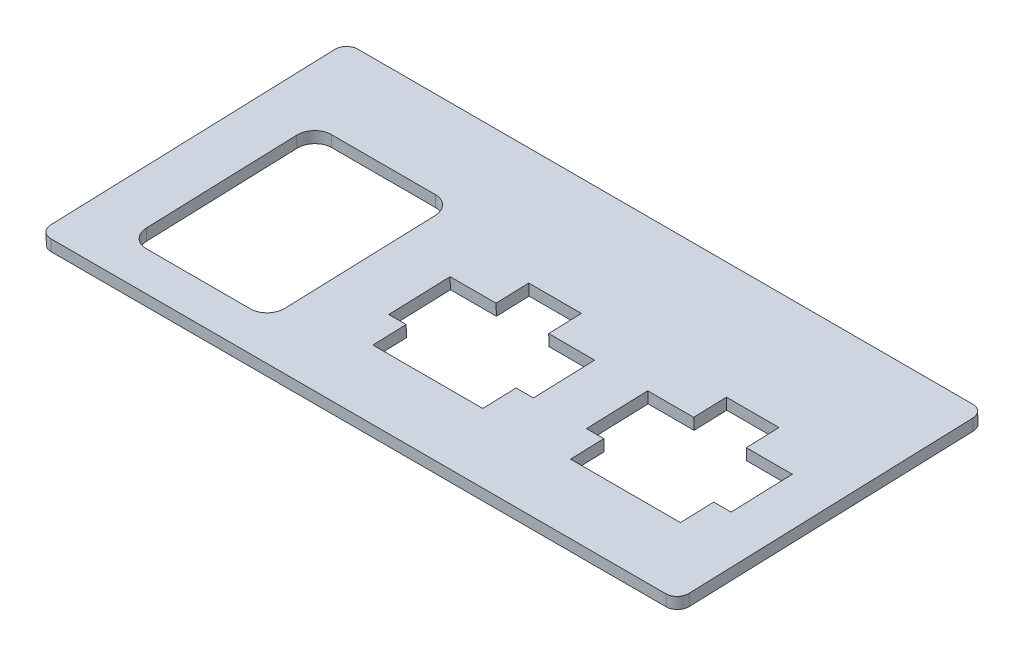
from build123d import *

# Parameters (mm, degrees)
SKETCH1_W           = 110.35
SKETCH1_H           = 53.101321069
BOSS_EXTRUDE1_DEPTH = 2
CUT_EXTRUDE1_REACH  = 75.66
FILLET1_R           = 2


with BuildPart() as part:
    # Sketch1 → Boss-Extrude1 (new body)
    with BuildSketch(Plane(origin=(0, -71.98718802, -2.513847999), x_dir=(1, 0, 0), z_dir=(0, 0.9993908270190958, 0.03489949670250105))):
        with Locations((0, 22.139065255)):
            Rectangle(SKETCH1_W, SKETCH1_H)
    extrude(amount=BOSS_EXTRUDE1_DEPTH)

    # Sketch2 → Cut-Extrude1 (cut, up to next)
    with BuildSketch(Plane(origin=(0, -71.98718802, -2.513847999), x_dir=(1, 0, 0), z_dir=(0, -0.9993908270190958, -0.03489949670250106)), mode=Mode.PRIVATE) as cut_extrude1_sk1:
        Polygon((-4.05, -23.464080484), (-4.05, -29.114080484), (5.05, -29.114080484), (5.05, -23.464080484), (13, -23.464080484), (13, -12.864080484), (10, -12.864080484), (10, -7.114080484), (-9, -7.114080484), (-9, -12.864080484), (-12, -12.864080484), (-12, -23.464080484), align=None)
    cut_extrude1_tool1 = extrude(cut_extrude1_sk1.sketch, amount=-CUT_EXTRUDE1_REACH, mode=Mode.PRIVATE) & part.part
    # Sketch2 → Cut-Extrude1 (cut, up to next)
    with BuildSketch(Plane(origin=(0, -71.98718802, -2.513847999), x_dir=(1, 0, 0), z_dir=(0, -0.9993908270190958, -0.03489949670250106)), mode=Mode.PRIVATE) as cut_extrude1_sk2:
        with BuildLine():
            Line((-43.175, -2.114080484), (-25.175, -2.114080484))
            ThreePointArc((-25.175, -2.114080484), (-23.053679656, -2.99276014), (-22.175, -5.114080484))
            Line((-22.175, -5.114080484), (-22.175, -31.114080484))
            ThreePointArc((-22.175, -31.114080484), (-23.053679656, -33.235400827), (-25.175, -34.114080484))
            Line((-25.175, -34.114080484), (-43.175, -34.114080484))
            ThreePointArc((-43.175, -34.114080484), (-45.296320344, -33.235400827), (-46.175, -31.114080484))
            Line((-46.175, -31.114080484), (-46.175, -5.114080484))
            ThreePointArc((-46.175, -5.114080484), (-45.296320344, -2.99276014), (-43.175, -2.114080484))
        make_face()
    cut_extrude1_tool2 = extrude(cut_extrude1_sk2.sketch, amount=-CUT_EXTRUDE1_REACH, mode=Mode.PRIVATE) & part.part
    # Sketch2 → Cut-Extrude1 (cut, up to next)
    with BuildSketch(Plane(origin=(0, -71.98718802, -2.513847999), x_dir=(1, 0, 0), z_dir=(0, -0.9993908270190958, -0.03489949670250106)), mode=Mode.PRIVATE) as cut_extrude1_sk3:
        Polygon((30.125, -23.464080484), (22.175, -23.464080484), (22.175, -12.864080484), (25.175, -12.864080484), (25.175, -7.114080484), (44.175, -7.114080484), (44.175, -12.864080484), (47.175, -12.864080484), (47.175, -23.464080484), (39.225, -23.464080484), (39.225, -29.114080484), (30.125, -29.114080484), align=None)
    cut_extrude1_tool3 = extrude(cut_extrude1_sk3.sketch, amount=-CUT_EXTRUDE1_REACH, mode=Mode.PRIVATE) & part.part
    add(cut_extrude1_tool1.solids().sort_by_distance((0.5, -71.392246, -19.550769))[0], mode=Mode.SUBTRACT)
    add(cut_extrude1_tool2.solids().sort_by_distance((-34.175, -71.355016, -20.616894))[0], mode=Mode.SUBTRACT)
    add(cut_extrude1_tool3.solids().sort_by_distance((34.675, -71.392246, -19.550769))[0], mode=Mode.SUBTRACT)

    # Fillet1
    fillet1_edges = [part.edges().sort_by_distance(p)[0] for p in [
        (-55.175, -71.141759648, 1.929959353),
        (55.175, -71.141759648, 1.929959353),
        (55.175, -69.288550269, -51.139013826),
        (-55.175, -69.288550269, -51.139013826),
    ]]
    fillet(fillet1_edges, radius=FILLET1_R)


solid = part.part
